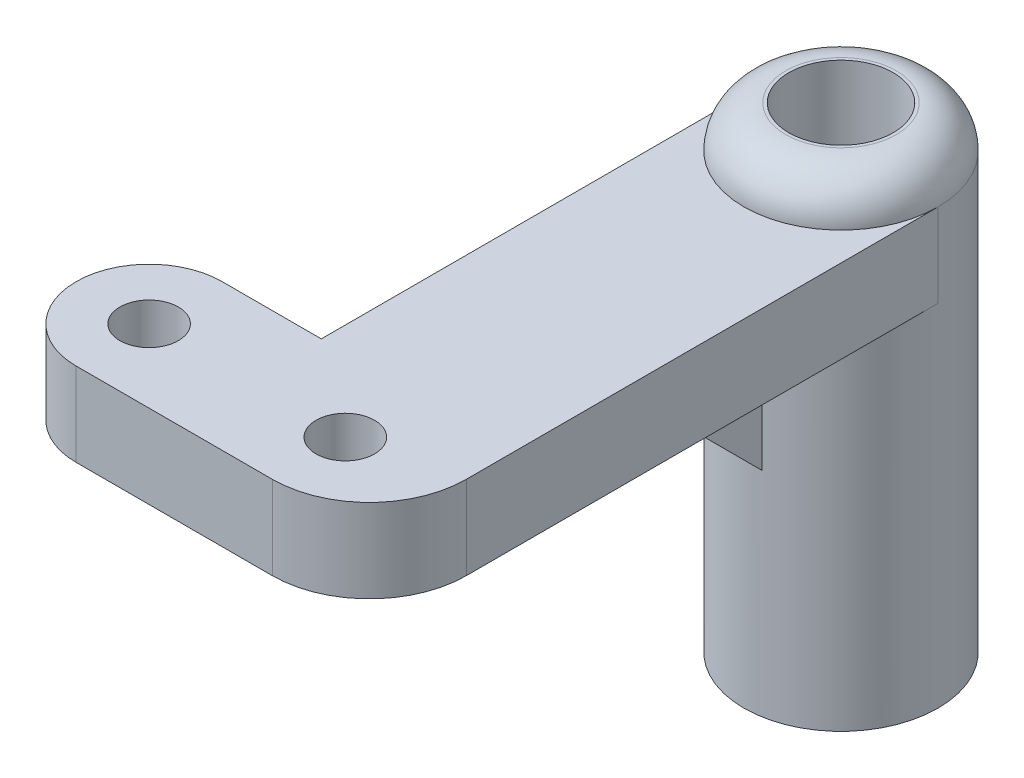
from build123d import *

# Parameters (mm, degrees)
SKETCH2_R           = 1.4
SKETCH2_R_2         = 2.5
BOSS_EXTRUDE1_DEPTH = 4
BOSS_EXTRUDE2_START = 16.8
SKETCH3_R           = 4.65
SKETCH3_R_2         = 2.5
BOSS_EXTRUDE2_DEPTH = 16.8
SKETCH5_R           = 4.65
SKETCH5_R_2         = 2.5
BOSS_EXTRUDE3_DEPTH = 2
FILLET1_R           = 2
RIB1_REACH          = 36.514
SKETCH6_WALL_W      = 80.220281068
SKETCH6_WALL_H      = 1.6


with BuildPart() as part:
    # Sketch2 → Boss-Extrude1 (new body)
    with BuildSketch(Plane(origin=(0, 0, 0), x_dir=(1, 0, 0), z_dir=(0, 1, 0))):
        with BuildLine():
            Line((-9.4, -4.65), (0, -4.65))
            ThreePointArc((0, -4.65), (3.288046533, -3.288046533), (4.65, 0))
            Line((4.65, 0), (4.65, 22.6))
            ThreePointArc((4.65, 22.6), (0, 27.25), (-4.65, 22.6))
            Line((-4.65, 22.6), (-4.65, 2.35))
            Line((-4.65, 2.35), (-9.4, 2.35))
            ThreePointArc((-9.4, 2.35), (-12.9, -1.15), (-9.4, -4.65))
        make_face()
        with Locations(Location((-9.4, -1.15, 0), (0, 0, 270))):
            Circle(SKETCH2_R, mode=Mode.SUBTRACT)
        with Locations(Location((0, -1.15, 0), (0, 0, 270))):
            Circle(SKETCH2_R, mode=Mode.SUBTRACT)
        with Locations(Location((0, 22.6, 0), (0, 0, 270))):
            Circle(SKETCH2_R_2, mode=Mode.SUBTRACT)
    extrude(amount=BOSS_EXTRUDE1_DEPTH)

    # Sketch3 → Boss-Extrude2 (add)
    with BuildSketch(Plane.XZ.offset(BOSS_EXTRUDE2_START)):
        with Locations((0, -22.6)):
            Circle(SKETCH3_R)
        with Locations(Location((0, -22.6, 0), (0, 0, 90))):
            Circle(SKETCH3_R_2, mode=Mode.SUBTRACT)
    extrude(amount=-BOSS_EXTRUDE2_DEPTH)

    # Sketch5 → Boss-Extrude3 (add)
    with BuildSketch(Plane(origin=(0, 4, 0), x_dir=(1, 0, 0), z_dir=(0, 1, 0))):
        with Locations(Location((0, 22.6, 0), (0, 0, 270))):
            Circle(SKETCH5_R)
        with Locations(Location((0, 22.6, 0), (0, 0, 270))):
            Circle(SKETCH5_R_2, mode=Mode.SUBTRACT)
    extrude(amount=BOSS_EXTRUDE3_DEPTH)

    # Fillet1
    fillet1_edges = [part.edges().sort_by_distance(p)[0] for p in [
        (0, 6, -27.25),
    ]]
    fillet(fillet1_edges, radius=FILLET1_R - 0.0001)  # a hair under: the kernel refuses the full size

    # Sketch6 wall → Rib1 (add, up to next)
    with BuildSketch(Plane(origin=(0, -3.25, -14.7), x_dir=(0, -0.707106781187, -0.707106781187), z_dir=(0, 0.707106781187, -0.707106781187)), mode=Mode.PRIVATE) as rib1_sk1:
        Rectangle(SKETCH6_WALL_W, SKETCH6_WALL_H)
    rib1_tool1 = extrude(rib1_sk1.sketch, amount=RIB1_REACH, mode=Mode.PRIVATE) - part.part
    add(rib1_tool1.solids().sort_by_distance((0, -3.25, -14.7))[0])


solid = part.part
